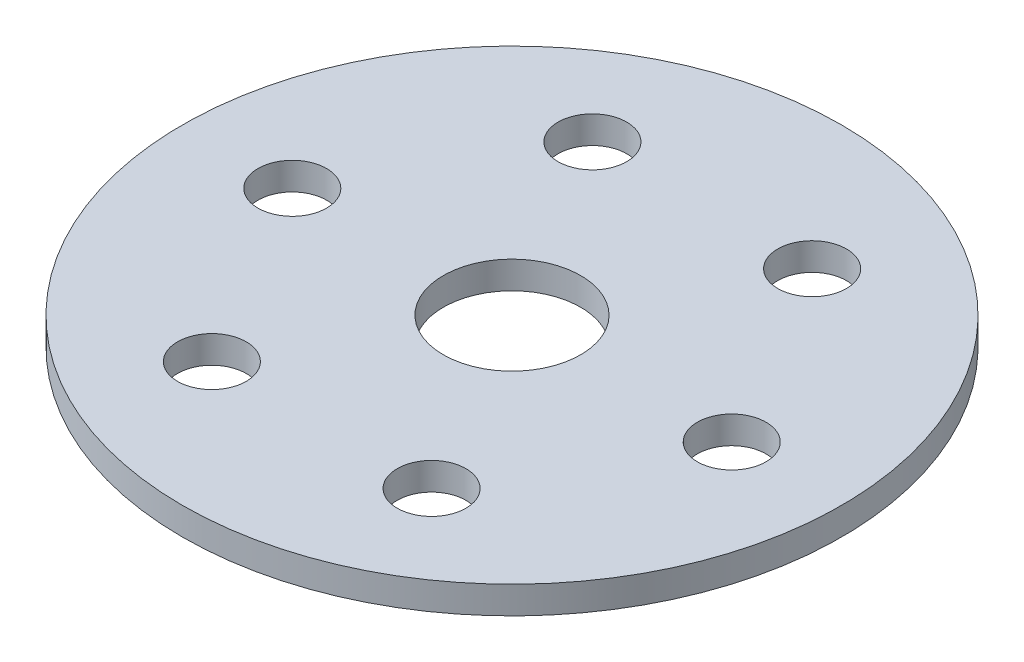
from build123d import *

# Parameters (mm, degrees)
SKETCH1_R                    = 76.2
SKETCH1_R_2                  = 15.875
PLATE_EXTRUDE_DEPTH          = 6.35
F_5_8_0_625_DIAMETER_HOLE1_D = 15.875
CIRPATTERN1_COUNT            = 6


with BuildPart() as part:
    # Sketch1 → Plate extrude (new body)
    with BuildSketch(Plane(origin=(0, 0, 0), x_dir=(1, 0, 0), z_dir=(0, 1, 0))):
        Circle(SKETCH1_R)
        Circle(SKETCH1_R_2, mode=Mode.SUBTRACT)
    extrude(amount=PLATE_EXTRUDE_DEPTH)

    # 5/8 (0.625) Diameter Hole1 (through all)
    with Locations(Plane(origin=(0, 6.35, 0), x_dir=(1, 0, 0), z_dir=(0, 1, 0))):
        with Locations((-50.8, 0)):
            f_5_8_0_625_diameter_hole1 = Hole(F_5_8_0_625_DIAMETER_HOLE1_D / 2)

    # CirPattern1: 5/8 (0.625) Diameter Hole1 ×6 about axis
    cirpattern1_axis = Axis((0, 6.35, 0), (0, -1, 0))
    for i in range(1, CIRPATTERN1_COUNT):
        add(f_5_8_0_625_diameter_hole1.rotate(cirpattern1_axis, i * 360 / CIRPATTERN1_COUNT), mode=Mode.SUBTRACT)


solid = part.part
